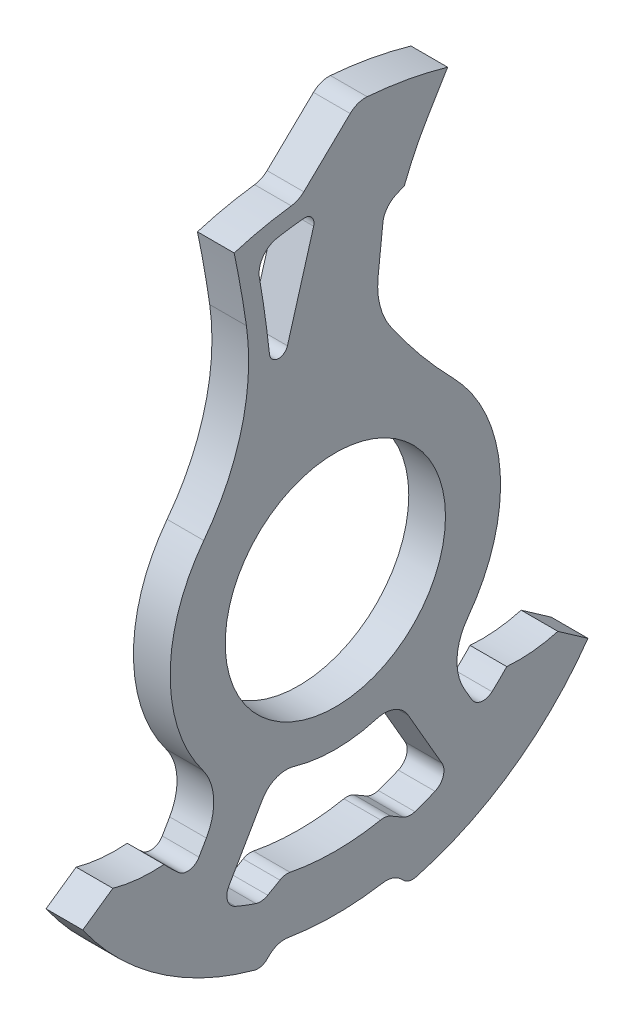
from build123d import *

# Parameters (mm, degrees)
SKETCH2_R           = 38.1
BOSS_EXTRUDE1_DEPTH = 6.35
CUT_EXTRUDE1_DEPTH  = 166.096382574
FILLET1_R           = 7.62
FILLET4_R           = 19.05
FILLET2_R           = 4.572
CUT_EXTRUDE2_DEPTH  = 165.922168179
FILLET3_R           = 5.08
FILLET5_R           = 9.525


with BuildPart() as part:
    # Sketch2 → Boss-Extrude1 (new, symmetric)
    with BuildSketch(Plane(origin=(0, 0, 0), x_dir=(0, 0, -1), z_dir=(1, 0, 0))):
        with BuildLine():
            Line((38.857972086, 134.186988957), (32.288511437, 123.318125779))
            ThreePointArc((32.288511437, 123.318125779), (27.710359244, 114.938607951), (23.879951403, 106.191964463))
            Line((23.879951403, 106.191964463), (16.910644846, 103.110866265))
            Line((16.910644846, 103.110866265), (14.787817679, 83.409798598))
            ThreePointArc((14.787817679, 83.409798598), (15.428874014, 74.413946756), (19.172898785, 66.209156564))
            ThreePointArc((19.172898785, 66.209156564), (29.463865029, 52.630213505), (40.856224374, 39.961123982))
            ThreePointArc((40.856224374, 39.961123982), (57.107890767, -2.193470331), (37.670623819, -42.977280057))
            Line((37.670623819, -42.977280057), (49.900086632, -64.159330998))
            ThreePointArc((49.900086632, -64.159330998), (54.760018309, -60.06478831), (59.285209805, -55.603078137))
            ThreePointArc((59.285209805, -55.603078137), (68.209440684, -55.534234835), (76.983909122, -53.904713488))
            Line((76.983909122, -53.904713488), (87.387140085, -61.18913423))
            ThreePointArc((87.387140085, -61.18913423), (60.250819498, -88.036703424), (25.4, -103.612076516))
            Line((25.4, -103.612076516), (20.08663208, -98.298708596))
            ThreePointArc((20.08663208, -98.298708596), (0, -100.33), (-20.08663208, -98.298708596))
            Line((-20.08663208, -98.298708596), (-25.4, -103.612076516))
            ThreePointArc((-25.4, -103.612076516), (-60.250819498, -88.036703424), (-87.387140085, -61.18913423))
            Line((-87.387140085, -61.18913423), (-76.983909122, -53.904713488))
            ThreePointArc((-76.983909122, -53.904713488), (-68.209440684, -55.534234835), (-59.285209805, -55.603078137))
            ThreePointArc((-59.285209805, -55.603078137), (-54.760018309, -60.06478831), (-49.900086632, -64.159330998))
            Line((-49.900086632, -64.159330998), (-37.670623819, -42.977280057))
            ThreePointArc((-37.670623819, -42.977280057), (-56.860198416, -5.74807238), (-45.50982475, 34.568458908))
            ThreePointArc((-45.50982475, 34.568458908), (-32.417804081, 61.576670544), (-30.771162792, 91.545538949))
            ThreePointArc((-30.771162792, 91.545538949), (-32.69751447, 103.536635229), (-35.005069856, 115.46024244))
            ThreePointArc((-35.005069856, 115.46024244), (-23.992858561, 118.24028602), (-12.768025153, 119.972496989))
            Line((-12.768025153, 119.972496989), (7.554913188, 139.495567265))
            ThreePointArc((7.554913188, 139.495567265), (23.357744557, 137.733459149), (38.857972086, 134.186988957))
        make_face()
        Circle(SKETCH2_R, mode=Mode.SUBTRACT)
    extrude(amount=BOSS_EXTRUDE1_DEPTH, both=True)

    # Sketch3 → Cut-Extrude1 (cut, through all)
    with BuildSketch(Plane(origin=(6.35, 0, 0), x_dir=(0, 0, -1), z_dir=(1, 0, 0))):
        with BuildLine():
            Line((-7.512977292, 109.738721888), (-16.576184766, 78.441038142))
            ThreePointArc((-16.576184766, 78.441038142), (-19.901101363, 76.161124206), (-22.78229081, 78.981022307))
            ThreePointArc((-22.78229081, 78.981022307), (-24.862407335, 94.998613906), (-27.608487184, 110.915559934))
            ThreePointArc((-27.608487184, 110.915559934), (-19.289815116, 112.660521181), (-10.864472489, 113.782482121))
            ThreePointArc((-10.864472489, 113.782482121), (-8.118145596, 112.647905196), (-7.512977292, 109.738721888))
        make_face()
    extrude(amount=-CUT_EXTRUDE1_DEPTH, mode=Mode.SUBTRACT)

    # Fillet1
    fillet1_edges = [part.edges().sort_by_distance(p)[0] for p in [
        (0, 103.110866265, -16.910644846),
        (0, 110.915559934, 27.608487184),
        (0, 139.495567265, -7.554913188),
        (0, 119.972496989, 12.768025153),
        (0, -98.298708596, -20.08663208),
        (0, -98.298708596, 20.08663208),
    ]]
    fillet(fillet1_edges, radius=FILLET1_R)

    # Fillet4
    fillet4_edges = [part.edges().sort_by_distance(p)[0] for p in [
        (0, -42.977280057, -37.670623819),
        (0, -42.977280057, 37.670623819),
    ]]
    fillet(fillet4_edges, radius=FILLET4_R)

    # Fillet2
    fillet2_edges = [part.edges().sort_by_distance(p)[0] for p in [
        (0, -103.612076516, 25.4),
        (0, -103.612076516, -25.4),
        (0, -64.159330998, -49.900086632),
        (0, -64.159330998, 49.900086632),
    ]]
    fillet(fillet2_edges, radius=FILLET2_R)

    # Sketch4 → Cut-Extrude2 (cut, through all)
    with BuildSketch(Plane(origin=(6.35, 0, 0), x_dir=(0, 0, -1), z_dir=(1, 0, 0))):
        with BuildLine():
            Line((-21.184299428, -46.172128582), (-39.645963646, -78.148669001))
            ThreePointArc((-39.645963646, -78.148669001), (-32.613253082, -81.335063923), (-25.327366164, -83.890055568))
            Line((-25.327366164, -83.890055568), (-17.5035126, -79.372951606))
            ThreePointArc((-17.5035126, -79.372951606), (-8.803547394, -80.801831373), (0, -81.28))
            Line((0, -81.28), (0, -50.8))
            ThreePointArc((0, -50.8), (-10.841952501, -49.629548315), (-21.184299428, -46.172128582))
        make_face()
    cut_extrude2 = extrude(amount=-CUT_EXTRUDE2_DEPTH, mode=Mode.SUBTRACT)

    # Mirror1: Cut-Extrude2 across plane
    add(cut_extrude2.mirror(Plane(origin=(-6.35, -81.28, 0), x_dir=(1, 0, 0), z_dir=(0, 0, -1))), mode=Mode.SUBTRACT)

    # Fillet3
    fillet3_edges = [part.edges().sort_by_distance(p)[0] for p in [
        (0, -78.148669001, -39.645963646),
        (0, -83.890055568, -25.327366164),
        (0, -79.372951606, -17.5035126),
        (0, -79.372951606, 17.5035126),
        (0, -83.890055568, 25.327366164),
        (0, -78.148669001, 39.645963646),
    ]]
    fillet(fillet3_edges, radius=FILLET3_R)

    # Fillet5
    fillet5_edges = [part.edges().sort_by_distance(p)[0] for p in [
        (0, -46.172128582, -21.184299428),
        (0, -46.172128582, 21.184299428),
    ]]
    fillet(fillet5_edges, radius=FILLET5_R)


solid = part.part
